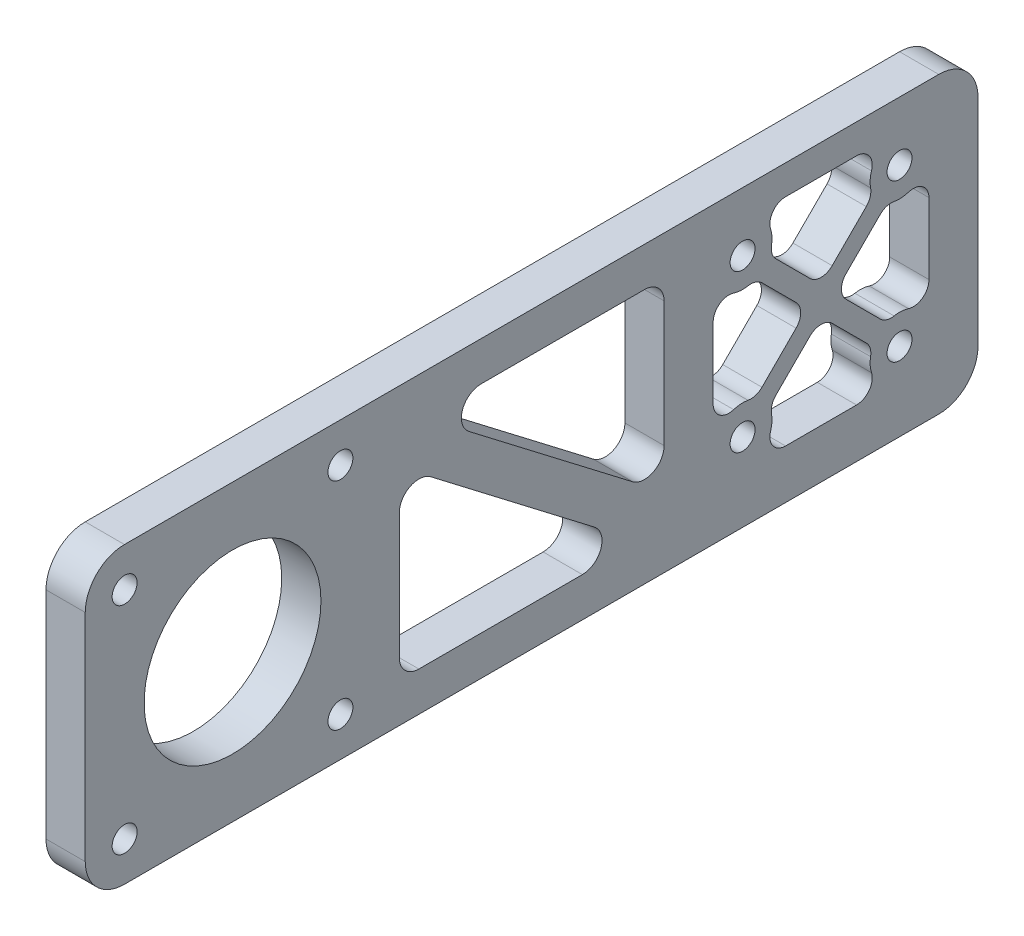
from build123d import *

# Parameters (mm, degrees)
SKETCH1_W              = 144.4879
SKETCH1_H              = 47.625
SKETCH1_R              = 14.3129
BOSS_EXTRUDE1_DEPTH    = 6.35
FILLET1_R              = 6.35
F_10_32_TAPPED_HOLE1_D = 4.0386
F_10_32_TAPPED_HOLE2_D = 4.0386
CUT_EXTRUDE1_DEPTH     = 147.5745916
FILLET2_R              = 2.54


with BuildPart() as part:
    # Sketch1 → Boss-Extrude1 (new body)
    with BuildSketch(Plane(origin=(0, 0, 0), x_dir=(0, 0, -1), z_dir=(1, 0, 0))):
        with Locations((-72.24395, 0)):
            Rectangle(SKETCH1_W, SKETCH1_H)
        with Locations((-120.65, 0)):
            Circle(SKETCH1_R, mode=Mode.SUBTRACT)
    extrude(amount=BOSS_EXTRUDE1_DEPTH)

    # Fillet1
    fillet1_edges = [part.edges().sort_by_distance(p)[0] for p in [
        (3.175, -23.8125, 144.4879),
        (3.175, 23.8125, 144.4879),
        (3.175, 23.8125, 0),
        (3.175, -23.8125, 0),
    ]]
    fillet(fillet1_edges, radius=FILLET1_R)

    # #10-32 Tapped Hole1 (through all)
    with Locations(Plane.ZY):
        with Locations((103.1875, 17.4625), (138.1125, 17.4625), (138.1125, -17.4625), (103.1875, -17.4625)):
            Hole(F_10_32_TAPPED_HOLE1_D / 2)

    # #10-32 Tapped Hole2 (through all)
    with Locations(Plane(origin=(6.35, 0, 0), x_dir=(0, 0, -1), z_dir=(1, 0, 0))):
        with Locations((-12.7, 14.2875), (-38.1, 14.2875), (-38.1, -11.1125), (-12.7, -11.1125)):
            Hole(F_10_32_TAPPED_HOLE2_D / 2)

    # Sketch8 → Cut-Extrude1 (cut, through all)
    with BuildSketch(Plane(origin=(6.35, 0, 0), x_dir=(0, 0, -1), z_dir=(1, 0, 0))):
        with BuildLine():
            Line((-80.436721657, 17.4625), (-53.975, 17.4625))
            ThreePointArc((-53.975, 17.4625), (-51.72993597, 16.53256403), (-50.8, 14.2875))
            Line((-50.8, 14.2875), (-50.8, -5.989274253))
            ThreePointArc((-50.8, -5.989274253), (-52.569784121, -8.836376874), (-55.906137534, -8.509459331))
            Line((-55.906137534, -8.509459331), (-82.367859191, 11.767314922))
            ThreePointArc((-82.367859191, 11.767314922), (-83.443564904, 15.307067893), (-80.436721657, 17.4625))
        make_face()
        with BuildLine():
            Line((-93.6625, 5.989274253), (-93.6625, -14.2875))
            ThreePointArc((-93.6625, -14.2875), (-92.73256403, -16.53256403), (-90.4875, -17.4625))
            Line((-90.4875, -17.4625), (-64.025778343, -17.4625))
            ThreePointArc((-64.025778343, -17.4625), (-61.018935096, -15.307067893), (-62.094640809, -11.767314922))
            Line((-62.094640809, -11.767314922), (-88.556362466, 8.509459331))
            ThreePointArc((-88.556362466, 8.509459331), (-91.892715879, 8.836376874), (-93.6625, 5.989274253))
        make_face()
        with BuildLine():
            Line((-38.1, 19.05), (-12.7, 19.05))
            ThreePointArc((-12.7, 19.05), (-16.728416874, 16.827827486), (-16.997532015, 12.235032015))
            Line((-16.997532015, 12.235032015), (-25.4, 3.83256403))
            Line((-25.4, 3.83256403), (-33.802467985, 12.235032015))
            ThreePointArc((-33.802467985, 12.235032015), (-34.071583126, 16.827827486), (-38.1, 19.05))
        make_face()
        with BuildLine():
            Line((-7.9375, 14.2875), (-7.9375, -11.1125))
            ThreePointArc((-7.9375, -11.1125), (-10.159672514, -7.084083126), (-14.752467985, -6.814967985))
            Line((-14.752467985, -6.814967985), (-23.15493597, 1.5875))
            Line((-23.15493597, 1.5875), (-14.752467985, 9.989967985))
            ThreePointArc((-14.752467985, 9.989967985), (-10.159672514, 10.259083126), (-7.9375, 14.2875))
        make_face()
        with BuildLine():
            Line((-38.1, -15.875), (-12.7, -15.875))
            ThreePointArc((-12.7, -15.875), (-16.728416874, -13.652827486), (-16.997532015, -9.060032015))
            Line((-16.997532015, -9.060032015), (-25.4, -0.65756403))
            Line((-25.4, -0.65756403), (-33.802467985, -9.060032015))
            ThreePointArc((-33.802467985, -9.060032015), (-34.071583126, -13.652827486), (-38.1, -15.875))
        make_face()
        with BuildLine():
            Line((-42.8625, 14.2875), (-42.8625, -11.1125))
            ThreePointArc((-42.8625, -11.1125), (-40.640327486, -7.084083126), (-36.047532015, -6.814967985))
            Line((-36.047532015, -6.814967985), (-27.64506403, 1.5875))
            Line((-27.64506403, 1.5875), (-36.047532015, 9.989967985))
            ThreePointArc((-36.047532015, 9.989967985), (-40.640327486, 10.259083126), (-42.8625, 14.2875))
        make_face()
    extrude(amount=-CUT_EXTRUDE1_DEPTH, mode=Mode.SUBTRACT)

    # Fillet2
    fillet2_edges = [part.edges().sort_by_distance(p)[0] for p in [
        (3.175, -15.875, 12.7),
    ]]
    fillet(fillet2_edges, radius=FILLET2_R)
    fillet2_2_edges = [part.edges().sort_by_distance(p)[0] for p in [
        (3.175, -9.060032015, 16.997532015),
    ]]
    fillet(fillet2_2_edges, radius=FILLET2_R)
    fillet2_3_edges = [part.edges().sort_by_distance(p)[0] for p in [
        (3.175, -0.65756403, 25.4),
    ]]
    fillet(fillet2_3_edges, radius=FILLET2_R)
    fillet2_4_edges = [part.edges().sort_by_distance(p)[0] for p in [
        (3.175, -9.060032015, 33.802467985),
    ]]
    fillet(fillet2_4_edges, radius=FILLET2_R)
    fillet2_5_edges = [part.edges().sort_by_distance(p)[0] for p in [
        (3.175, 14.2875, 42.8625),
    ]]
    fillet(fillet2_5_edges, radius=FILLET2_R)
    fillet2_6_edges = [part.edges().sort_by_distance(p)[0] for p in [
        (3.175, -6.814967985, 36.047532015),
    ]]
    fillet(fillet2_6_edges, radius=FILLET2_R)
    fillet2_7_edges = [part.edges().sort_by_distance(p)[0] for p in [
        (3.175, 1.5875, 27.64506403),
    ]]
    fillet(fillet2_7_edges, radius=FILLET2_R)
    fillet2_8_edges = [part.edges().sort_by_distance(p)[0] for p in [
        (3.175, 9.989967985, 36.047532015),
    ]]
    fillet(fillet2_8_edges, radius=FILLET2_R)
    fillet2_9_edges = [part.edges().sort_by_distance(p)[0] for p in [
        (3.175, 14.2875, 7.9375),
    ]]
    fillet(fillet2_9_edges, radius=FILLET2_R)
    fillet2_10_edges = [part.edges().sort_by_distance(p)[0] for p in [
        (3.175, 9.989967985, 14.752467985),
    ]]
    fillet(fillet2_10_edges, radius=FILLET2_R)
    fillet2_11_edges = [part.edges().sort_by_distance(p)[0] for p in [
        (3.175, 1.5875, 23.15493597),
    ]]
    fillet(fillet2_11_edges, radius=FILLET2_R)
    fillet2_12_edges = [part.edges().sort_by_distance(p)[0] for p in [
        (3.175, -6.814967985, 14.752467985),
    ]]
    fillet(fillet2_12_edges, radius=FILLET2_R)
    fillet2_13_edges = [part.edges().sort_by_distance(p)[0] for p in [
        (3.175, -11.1125, 7.9375),
    ]]
    fillet(fillet2_13_edges, radius=FILLET2_R)
    fillet2_14_edges = [part.edges().sort_by_distance(p)[0] for p in [
        (3.175, 19.05, 38.1),
    ]]
    fillet(fillet2_14_edges, radius=FILLET2_R)
    fillet2_15_edges = [part.edges().sort_by_distance(p)[0] for p in [
        (3.175, 12.235032015, 33.802467985),
    ]]
    fillet(fillet2_15_edges, radius=FILLET2_R)
    fillet2_16_edges = [part.edges().sort_by_distance(p)[0] for p in [
        (3.175, 3.83256403, 25.4),
    ]]
    fillet(fillet2_16_edges, radius=FILLET2_R)
    fillet2_17_edges = [part.edges().sort_by_distance(p)[0] for p in [
        (3.175, 12.235032015, 16.997532015),
    ]]
    fillet(fillet2_17_edges, radius=FILLET2_R)
    fillet2_18_edges = [part.edges().sort_by_distance(p)[0] for p in [
        (3.175, 19.05, 12.7),
    ]]
    fillet(fillet2_18_edges, radius=FILLET2_R)
    fillet2_19_edges = [part.edges().sort_by_distance(p)[0] for p in [
        (3.175, -15.875, 38.1),
    ]]
    fillet(fillet2_19_edges, radius=FILLET2_R)
    fillet2_20_edges = [part.edges().sort_by_distance(p)[0] for p in [
        (3.175, -11.1125, 42.8625),
    ]]
    fillet(fillet2_20_edges, radius=FILLET2_R)


solid = part.part
